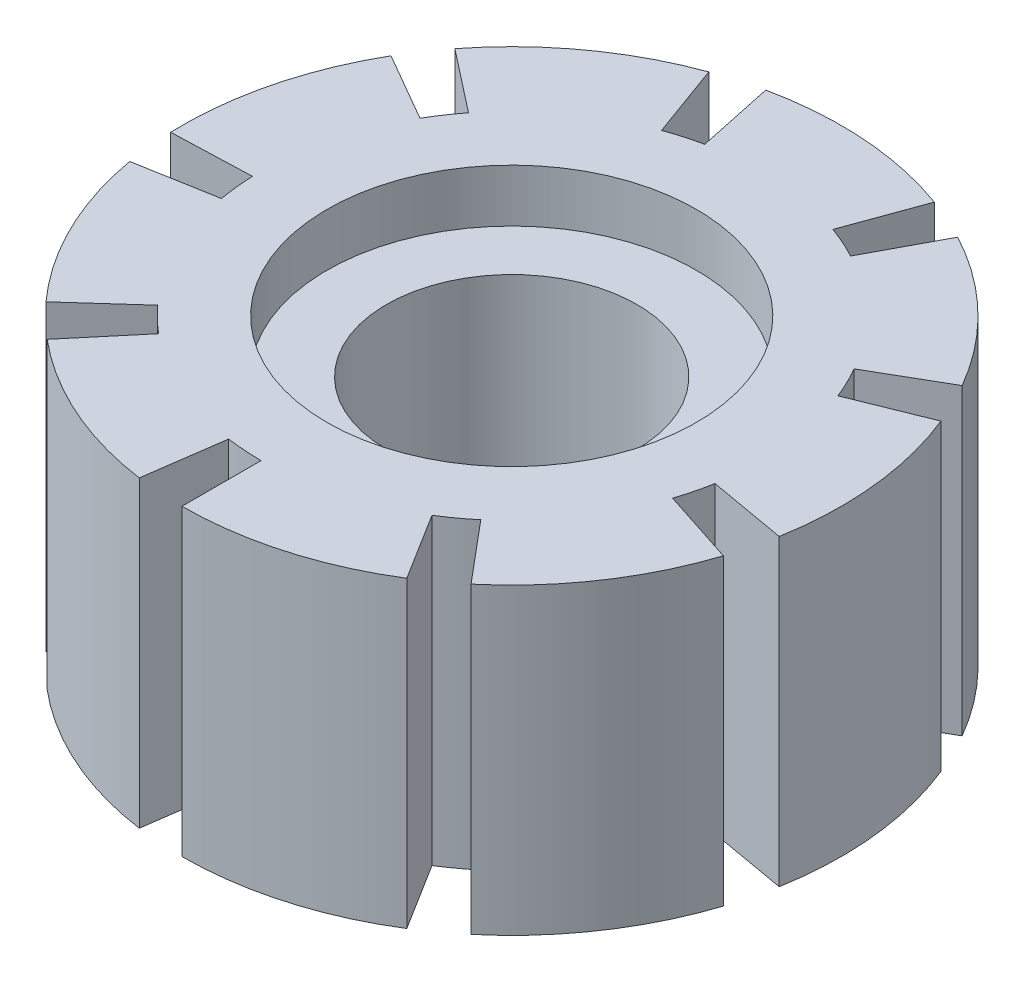
from build123d import *

# Parameters (mm, degrees)
SKETCH1_R           = 25
SKETCH1_R_2         = 9.5
BOSS_EXTRUDE1_DEPTH = 15
SKETCH2_R           = 25
SKETCH2_R_2         = 14
BOSS_EXTRUDE2_DEPTH = 4
CUT_EXTRUDE1_DEPTH  = 43.178193418
CIRPATTERN1_COUNT   = 9


with BuildPart() as part:
    # Sketch1 → Boss-Extrude1 (new body)
    with BuildSketch(Plane(origin=(0, 0, 0), x_dir=(1, 0, 0), z_dir=(0, 1, 0))):
        Circle(SKETCH1_R)
        Circle(SKETCH1_R_2, mode=Mode.SUBTRACT)
    extrude(amount=BOSS_EXTRUDE1_DEPTH)

    # Sketch2 → Boss-Extrude2 (add)
    with BuildSketch(Plane(origin=(0, 15, 0), x_dir=(1, 0, 0), z_dir=(0, 1, 0))):
        Circle(SKETCH2_R)
        Circle(SKETCH2_R_2, mode=Mode.SUBTRACT)
    boss_extrude2 = extrude(amount=BOSS_EXTRUDE2_DEPTH)

    # Mirror1: Boss-Extrude2 across plane
    add(boss_extrude2.mirror(Plane.ZX.offset(7.5)))

    # Sketch6 → Cut-Extrude1 (cut, through all)
    with BuildSketch(Plane.XZ.offset(4)):
        with BuildLine():
            Line((-3.479327524, 24.756701719), (-2.644288918, 18.815093306))
            ThreePointArc((-2.644288918, 18.815093306), (-1.325373001, 18.953716955), (0, 19))
            Line((0, 19), (0, 25))
            ThreePointArc((0, 25), (-1.743911844, 24.939101256), (-3.479327524, 24.756701719))
        make_face()
    cut_extrude1 = extrude(amount=-CUT_EXTRUDE1_DEPTH, mode=Mode.SUBTRACT)

    # CirPattern1: Cut-Extrude1 ×9 about axis
    cirpattern1_axis = Axis((0, 15, 0), (0, -1, 0))
    for i in range(1, CIRPATTERN1_COUNT):
        add(cut_extrude1.rotate(cirpattern1_axis, i * 360 / CIRPATTERN1_COUNT), mode=Mode.SUBTRACT)


solid = part.part
